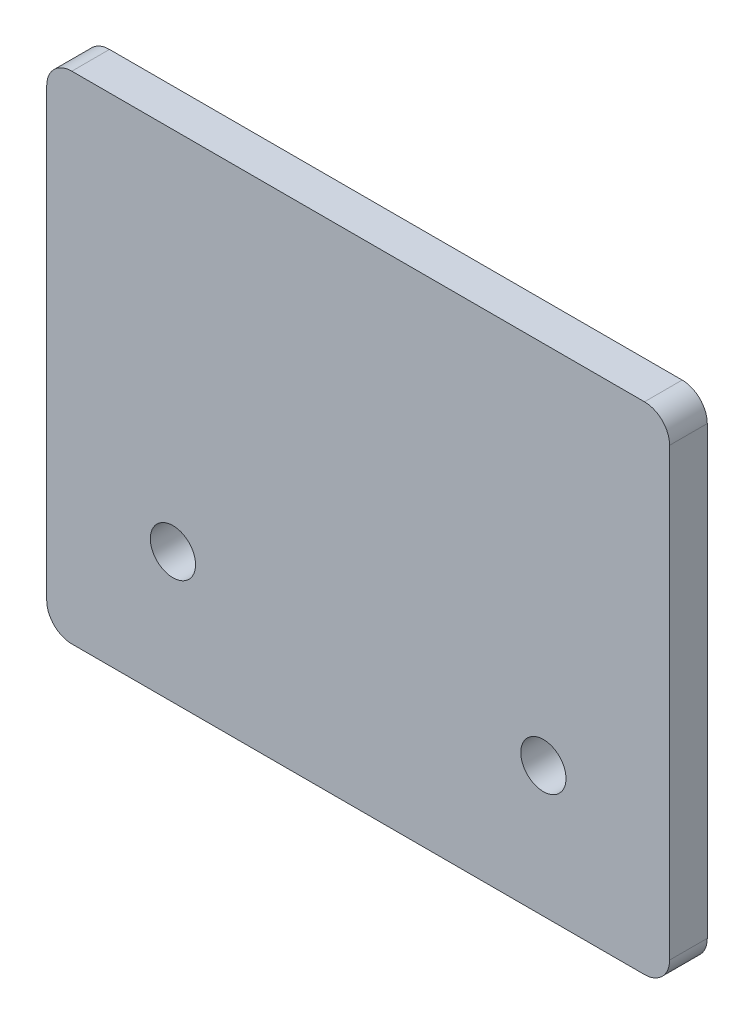
from build123d import *

# Parameters (mm, degrees)
SKETCH1_W           = 49.6
SKETCH1_H           = 40
SKETCH1_R           = 1.8
BOSS_EXTRUDE1_DEPTH = 3
SKETCH2_W           = 49.6
SKETCH2_H           = 3
CUT_EXTRUDE1_DEPTH  = 0.5
FILLET1_R           = 2


with BuildPart() as part:
    # Sketch1 → Boss-Extrude1 (new body)
    with BuildSketch(Plane.XY):
        with Locations((-43.012787822, 28.211435671)):
            Rectangle(SKETCH1_W, SKETCH1_H)
        with Locations((-28.262787822, 19.101262419)):
            Circle(SKETCH1_R, mode=Mode.SUBTRACT)
        with Locations((-57.762787822, 19.101262419)):
            Circle(SKETCH1_R, mode=Mode.SUBTRACT)
    extrude(amount=BOSS_EXTRUDE1_DEPTH)

    # Sketch2 → Cut-Extrude1 (cut)
    with BuildSketch(Plane.XZ.offset(-8.211435671)):
        with Locations((-43.012787822, 1.5)):
            Rectangle(SKETCH2_W, SKETCH2_H)
    extrude(amount=-CUT_EXTRUDE1_DEPTH, mode=Mode.SUBTRACT)

    # Fillet1
    fillet1_edges = [part.edges().sort_by_distance(p)[0] for p in [
        (-18.212787822, 48.211435671, 1.5),
        (-18.212787822, 8.711435671, 1.5),
        (-67.812787822, 48.211435671, 1.5),
        (-67.812787822, 8.711435671, 1.5),
    ]]
    fillet(fillet1_edges, radius=FILLET1_R)


solid = part.part
